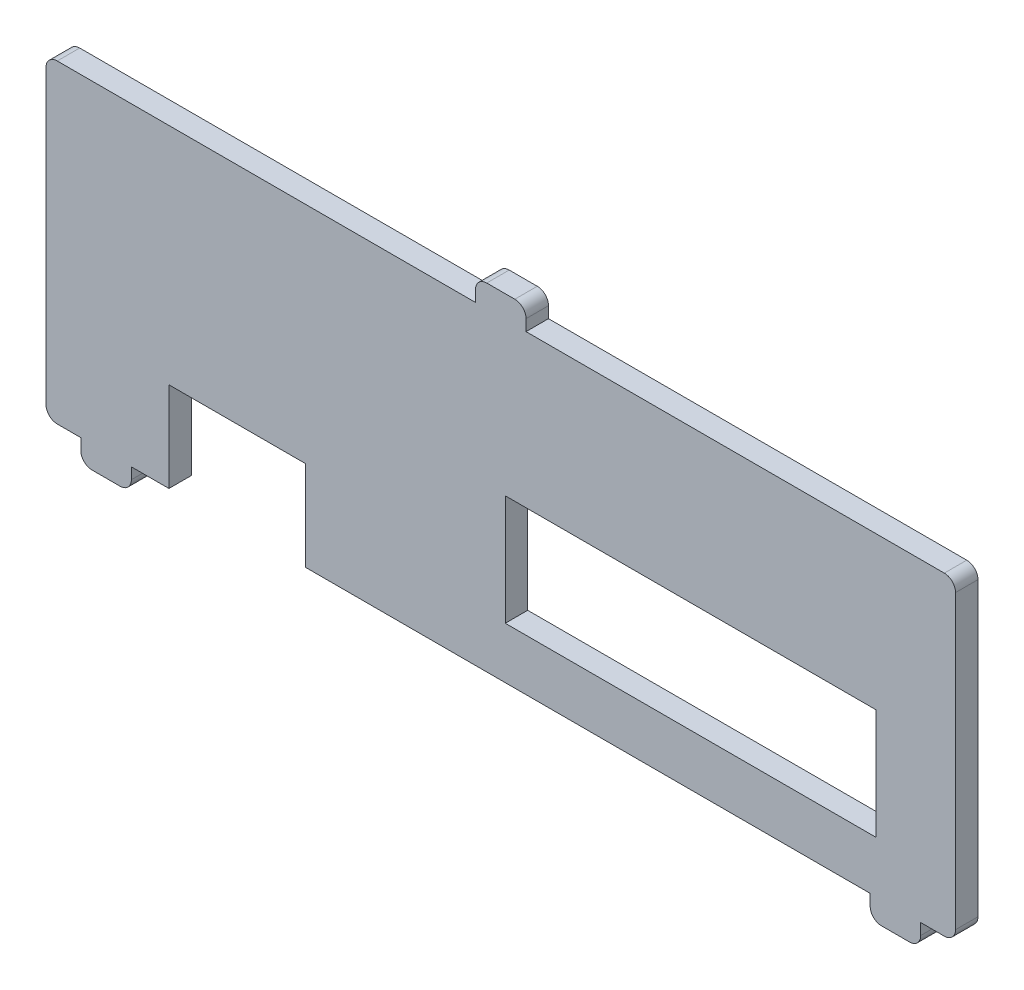
from build123d import *

# Parameters (mm, degrees)
BOSS_EXTRUDE1_DEPTH = 1
FILLET1_R           = 1
CUT_EXTRUDE1_REACH  = 45.592
SKETCH3_W           = 33
SKETCH3_H           = 9.834770164
SKETCH3_W_2         = 12.143293017
SKETCH3_H_2         = 8


with BuildPart() as part:
    # Sketch1 → Boss-Extrude1 (new, symmetric)
    with BuildSketch(Plane.XY):
        Polygon((-2.25, 14), (-40.5, 14), (-40.5, -14), (-37.4, -14), (-37.4, -16), (-32.9, -16), (-32.9, -14), (32.9, -14), (32.9, -16), (37.4, -16), (37.4, -14), (40.5, -14), (40.5, 14), (2.25, 14), (2.25, 16), (-2.25, 16), align=None)
    extrude(amount=BOSS_EXTRUDE1_DEPTH, both=True)

    # Fillet1
    fillet1_edges = [part.edges().sort_by_distance(p)[0] for p in [
        (-40.5, 14, 0),
        (-32.9, -16, 0),
        (-37.4, -16, 0),
        (-40.5, -14, 0),
        (32.9, -16, 0),
        (37.4, -16, 0),
        (40.5, -14, 0),
        (40.5, 14, 0),
        (2.25, 16, 0),
        (-2.25, 16, 0),
    ]]
    fillet(fillet1_edges, radius=FILLET1_R)

    # Sketch3 → Cut-Extrude1 (cut, up to next)
    with BuildSketch(Plane(origin=(0, 0, -1), x_dir=(-1, 0, 0), z_dir=(0, 0, -1)), mode=Mode.PRIVATE) as cut_extrude1_sk1:
        with Locations((-16.9, -4.5)):
            Rectangle(SKETCH3_W, SKETCH3_H)
    cut_extrude1_tool1 = extrude(cut_extrude1_sk1.sketch, amount=-CUT_EXTRUDE1_REACH, mode=Mode.PRIVATE) & part.part
    # Sketch3 → Cut-Extrude1 (cut, up to next)
    with BuildSketch(Plane(origin=(0, 0, -1), x_dir=(-1, 0, 0), z_dir=(0, 0, -1)), mode=Mode.PRIVATE) as cut_extrude1_sk2:
        with Locations((23.481316844, -10)):
            Rectangle(SKETCH3_W_2, SKETCH3_H_2)
    cut_extrude1_tool2 = extrude(cut_extrude1_sk2.sketch, amount=-CUT_EXTRUDE1_REACH, mode=Mode.PRIVATE) & part.part
    add(cut_extrude1_tool1.solids().sort_by_distance((16.9, -4.5, -1))[0], mode=Mode.SUBTRACT)
    add(cut_extrude1_tool2.solids().sort_by_distance((-23.481317, -10, -1))[0], mode=Mode.SUBTRACT)


solid = part.part
